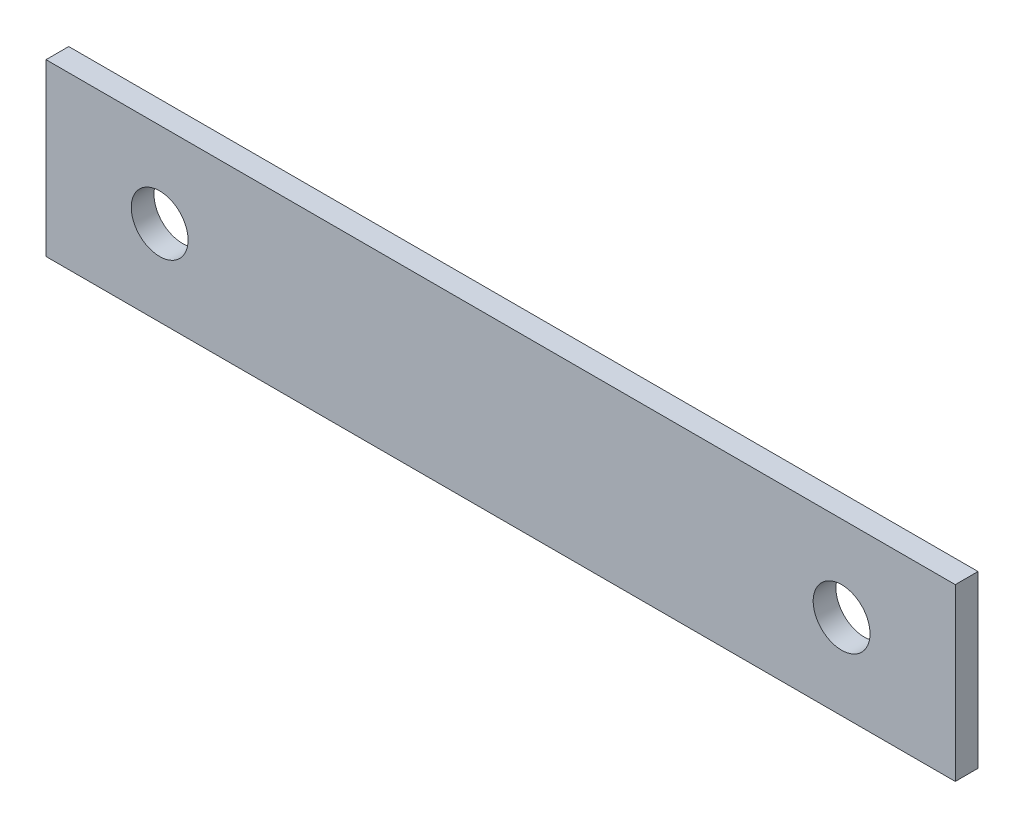
from build123d import *

# Parameters (mm, degrees)
SKETCH1_W          = 80
SKETCH1_H          = 15
BASE_FLANGE1_DEPTH = 2
CUT_EXTRUDE1_REACH = 83.419
SKETCH6_R          = 2.5


# Sheet-metal steps are written as plain solids
with BuildPart() as part:
    # Sketch1 → Base-Flange1 (new body)
    with BuildSketch(Plane.XY):
        with Locations((40, 7.5)):
            Rectangle(SKETCH1_W, SKETCH1_H)
    extrude(amount=-BASE_FLANGE1_DEPTH)

    # Sketch6 → Cut-Extrude1 (cut, up to next)
    with BuildSketch(Plane.XY, mode=Mode.PRIVATE) as cut_extrude1_sk1:
        with Locations((10, 7.5)):
            Circle(SKETCH6_R)
    cut_extrude1_tool1 = extrude(cut_extrude1_sk1.sketch, amount=-CUT_EXTRUDE1_REACH, mode=Mode.PRIVATE) & part.part
    # Sketch6 → Cut-Extrude1 (cut, up to next)
    with BuildSketch(Plane.XY, mode=Mode.PRIVATE) as cut_extrude1_sk2:
        with Locations((70, 7.5)):
            Circle(SKETCH6_R)
    cut_extrude1_tool2 = extrude(cut_extrude1_sk2.sketch, amount=-CUT_EXTRUDE1_REACH, mode=Mode.PRIVATE) & part.part
    add(cut_extrude1_tool1.solids().sort_by_distance((10, 7.5, 0))[0], mode=Mode.SUBTRACT)
    add(cut_extrude1_tool2.solids().sort_by_distance((70, 7.5, 0))[0], mode=Mode.SUBTRACT)


solid = part.part
